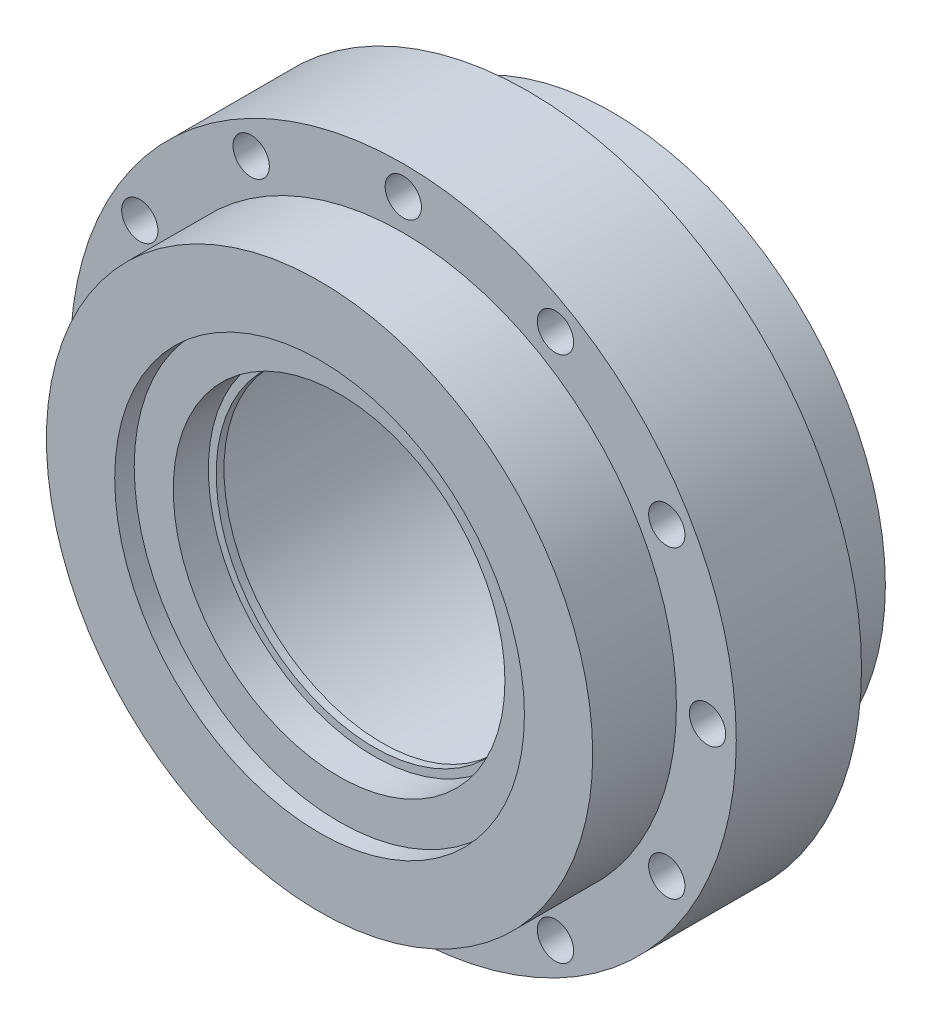
from build123d import *

# Parameters (mm, degrees)
SKETCH2_R                  = 4
CUT_EXTRUDE1_DEPTH         = 10
M8X1_25_TAPPED_HOLE2_D     = 6.8
M8X1_25_TAPPED_HOLE2_DEPTH = 19.75
M8X1_25_TAPPED_HOLE2_TIP   = 2.042926105
SKETCH7_W                  = 32.09110021
SKETCH7_H                  = 15.334740526
SKETCH8_R                  = 4.652226046
CUT_EXTRUDE2_DEPTH         = 133.027125309


with BuildPart() as part:
    # Sketch1 → Revolve1 (revolve)
    with BuildSketch(Plane(origin=(0, 0, 0), x_dir=(0, 0, -1), z_dir=(1, 0, 0))):
        Polygon((-84.79575879, 52.5), (-79.79575879, 52.5), (-79.79575879, 42.5), (-70.79575879, 42.5), (-70.79575879, 40.5), (-68.79575879, 40.5), (-68.79575879, 55), (-9.79575879, 55), (-9.79575879, 70), (-84.79575879, 70), align=None)
    revolve(axis=Axis((0, 0, 163.822734484), (0, 0, -1)))

    # Sketch2 → Cut-Extrude1 (cut)
    with BuildSketch(Plane(origin=(0, 0, 9.79575879), x_dir=(-1, 0, 0), z_dir=(0, 0, -1))):
        with Locations((0, 62.5)):
            Circle(SKETCH2_R)
        with Locations((0, -62.5)):
            Circle(SKETCH2_R)
    extrude(amount=-CUT_EXTRUDE1_DEPTH, mode=Mode.SUBTRACT)

    # M8x1.25 Tapped Hole2
    with Locations(Plane(origin=(0, 0, 0), x_dir=(1, 0, 0), z_dir=(0, 0, -1))):
        with Locations((-54.126587737, -31.25), (-31.25, -54.126587737), (-62.5, 0), (31.25, -54.126587737), (62.5, 0), (54.126587737, 31.25), (31.25, 54.126587737), (-31.25, 54.126587737), (-54.126587737, 31.25)):
            Hole(M8X1_25_TAPPED_HOLE2_D / 2, depth=M8X1_25_TAPPED_HOLE2_DEPTH)
            with Locations((0, 0, -(M8X1_25_TAPPED_HOLE2_DEPTH + M8X1_25_TAPPED_HOLE2_TIP / 2))):  # 118° drill point
                Cone(0, M8X1_25_TAPPED_HOLE2_D / 2, M8X1_25_TAPPED_HOLE2_TIP, mode=Mode.SUBTRACT)

    # Sketch7 → Revolve2 (revolve)
    with BuildSketch(Plane(origin=(0, 0, 0), x_dir=(0, 0, -1), z_dir=(1, 0, 0))):
        with Locations((-47.29575879, 77.667370263)):
            Rectangle(SKETCH7_W, SKETCH7_H)
    revolve(axis=Axis((0, 0, 163.822734484), (0, 0, -1)))

    # Sketch8 → Cut-Extrude2 (cut, through all)
    with BuildSketch(Plane(origin=(0, 0, 31.250208685), x_dir=(-1, 0, 0), z_dir=(0, 0, -1))):
        with Locations((0, 77.969134613)):
            Circle(SKETCH8_R)
        with Locations((38.984567307, 67.523251286)):
            Circle(SKETCH8_R)
        with Locations((67.523251286, 38.984567307)):
            Circle(SKETCH8_R)
        with Locations((77.969134613, 0)):
            Circle(SKETCH8_R)
        with Locations((67.523251286, -38.984567307)):
            Circle(SKETCH8_R)
        with Locations((38.984567307, -67.523251286)):
            Circle(SKETCH8_R)
        with Locations((0, -77.969134613)):
            Circle(SKETCH8_R)
        with Locations((-38.984567307, -67.523251286)):
            Circle(SKETCH8_R)
        with Locations((-67.523251286, -38.984567307)):
            Circle(SKETCH8_R)
        with Locations((-77.969134613, 0)):
            Circle(SKETCH8_R)
        with Locations((-67.523251286, 38.984567307)):
            Circle(SKETCH8_R)
        with Locations((-38.984567307, 67.523251286)):
            Circle(SKETCH8_R)
    extrude(amount=-CUT_EXTRUDE2_DEPTH, mode=Mode.SUBTRACT)


solid = part.part
